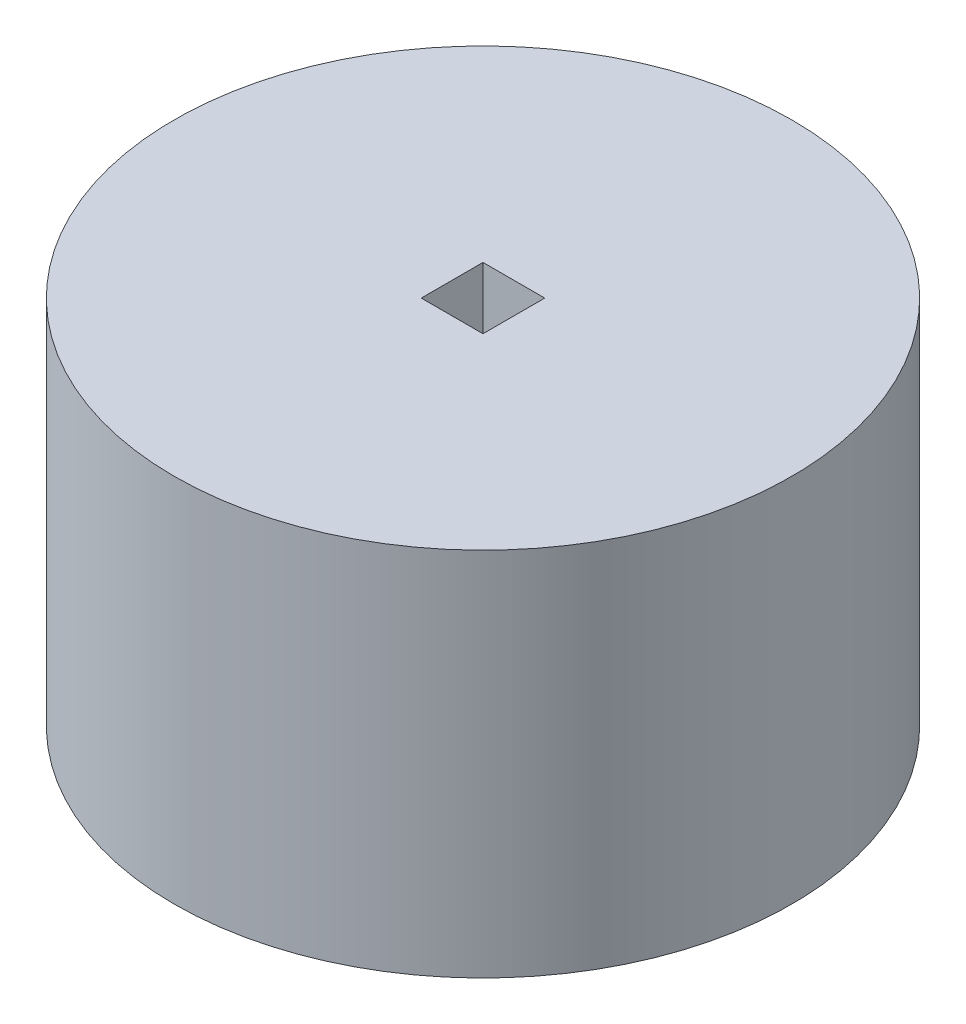
from build123d import *

# Parameters (mm, degrees)
SKETCH1_R           = 25
BOSS_EXTRUDE1_DEPTH = 30
SKETCH2_R           = 13.1
CUT_EXTRUDE1_DEPTH  = 7.9
SKETCH3_R           = 1.5
CUT_EXTRUDE2_DEPTH  = 47.368092477
SKETCH4_W           = 5
SKETCH4_H           = 5
CUT_EXTRUDE3_DEPTH  = 10


with BuildPart() as part:
    # Sketch1 → Boss-Extrude1 (new body)
    with BuildSketch(Plane(origin=(0, 0, 0), x_dir=(1, 0, 0), z_dir=(0, 1, 0))):
        Circle(SKETCH1_R)
    extrude(amount=BOSS_EXTRUDE1_DEPTH)

    # Sketch2 → Cut-Extrude1 (cut)
    with BuildSketch(Plane.XZ):
        Circle(SKETCH2_R)
    extrude(amount=-CUT_EXTRUDE1_DEPTH, mode=Mode.SUBTRACT)

    # Sketch3 → Cut-Extrude2 (cut, through all)
    with BuildSketch(Plane(origin=(0, 30, 0), x_dir=(1, 0, 0), z_dir=(0, 1, 0))):
        Circle(SKETCH3_R)
    extrude(amount=-CUT_EXTRUDE2_DEPTH, mode=Mode.SUBTRACT)

    # Sketch4 → Cut-Extrude3 (cut)
    with BuildSketch(Plane(origin=(0, 30, 0), x_dir=(1, 0, 0), z_dir=(0, 1, 0))):
        Rectangle(SKETCH4_W, SKETCH4_H)
    extrude(amount=-CUT_EXTRUDE3_DEPTH, mode=Mode.SUBTRACT)


solid = part.part
